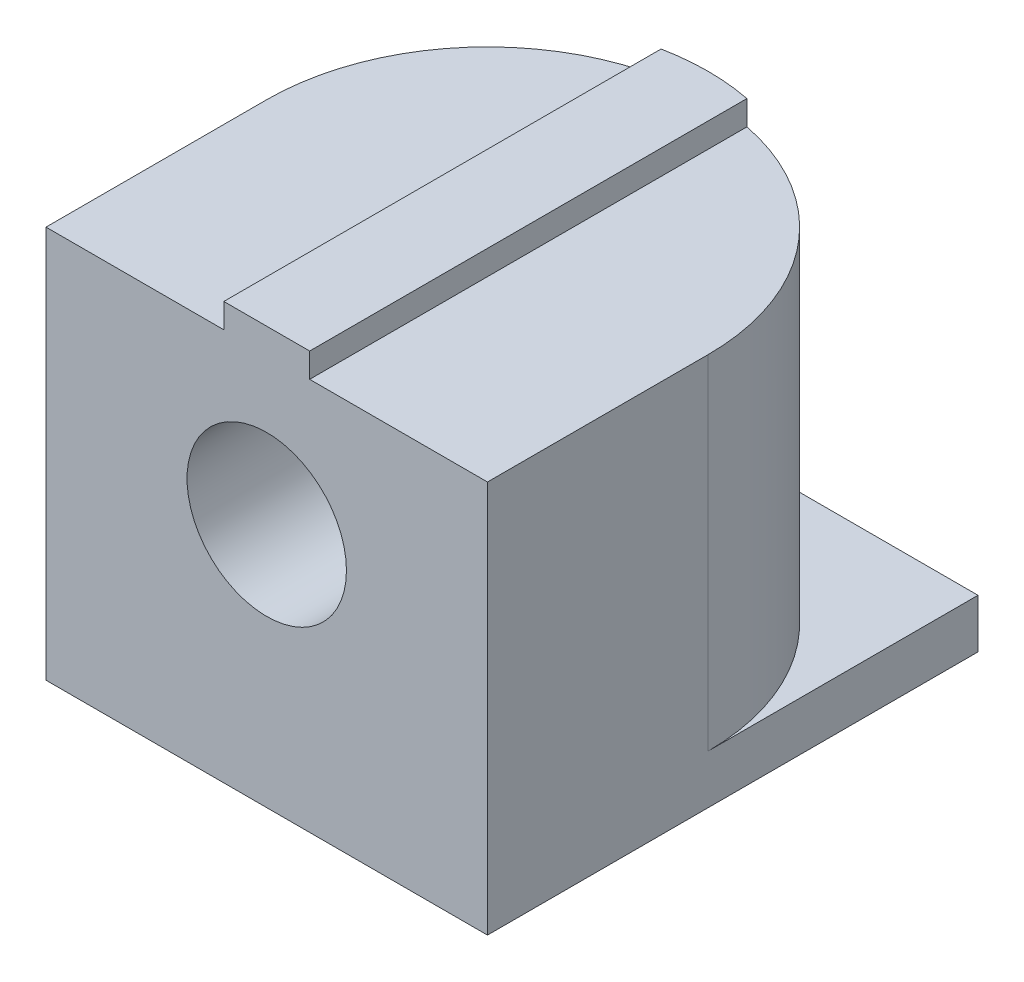
from build123d import *

# Parameters (mm, degrees)
SKETCH1_W           = 9
SKETCH1_H           = 10
BOSS_EXTRUDE1_DEPTH = 1
SKETCH2_W           = 9
SKETCH2_H           = 9
BOSS_EXTRUDE2_DEPTH = 7
FILLET1_R           = 4.5
BOSS_EXTRUDE3_DEPTH = 0.5
SKETCH4_R           = 1.625
CUT_EXTRUDE1_DEPTH  = 6


with BuildPart() as part:
    # Sketch1 → Boss-Extrude1 (new body)
    with BuildSketch(Plane(origin=(0, 0, 0), x_dir=(1, 0, 0), z_dir=(0, 1, 0))):
        Rectangle(SKETCH1_W, SKETCH1_H)
    extrude(amount=BOSS_EXTRUDE1_DEPTH)

    # Sketch2 → Boss-Extrude2 (add)
    with BuildSketch(Plane(origin=(0, 1, 0), x_dir=(1, 0, 0), z_dir=(0, 1, 0))):
        with Locations((0, -0.5)):
            Rectangle(SKETCH2_W, SKETCH2_H)
    extrude(amount=BOSS_EXTRUDE2_DEPTH)

    # Fillet1
    fillet1_edges = [part.edges().sort_by_distance(p)[0] for p in [
        (-4.5, 4.5, -4),
        (4.5, 4.5, -4),
    ]]
    fillet(fillet1_edges, radius=FILLET1_R - 0.0001)  # a hair under: the kernel refuses the full size

    # Sketch3 → Boss-Extrude3 (add)
    with BuildSketch(Plane(origin=(0, 8, 0), x_dir=(1, 0, 0), z_dir=(0, 1, 0))):
        with BuildLine():
            Line((-0.875, 3.914110896), (-0.875, -5))
            Line((-0.875, -5), (0.875, -5))
            Line((0.875, -5), (0.875, 3.914110896))
            ThreePointArc((0.875, 3.914110896), (0.439602644, 3.978476249), (0, 4))
            ThreePointArc((0, 4), (-0.439602644, 3.978476249), (-0.875, 3.914110896))
        make_face()
    extrude(amount=BOSS_EXTRUDE3_DEPTH)

    # Sketch4 → Cut-Extrude1 (cut)
    with BuildSketch(Plane.XY.offset(5)):
        with Locations((0, 5)):
            Circle(SKETCH4_R)
    extrude(amount=-CUT_EXTRUDE1_DEPTH, mode=Mode.SUBTRACT)


solid = part.part
